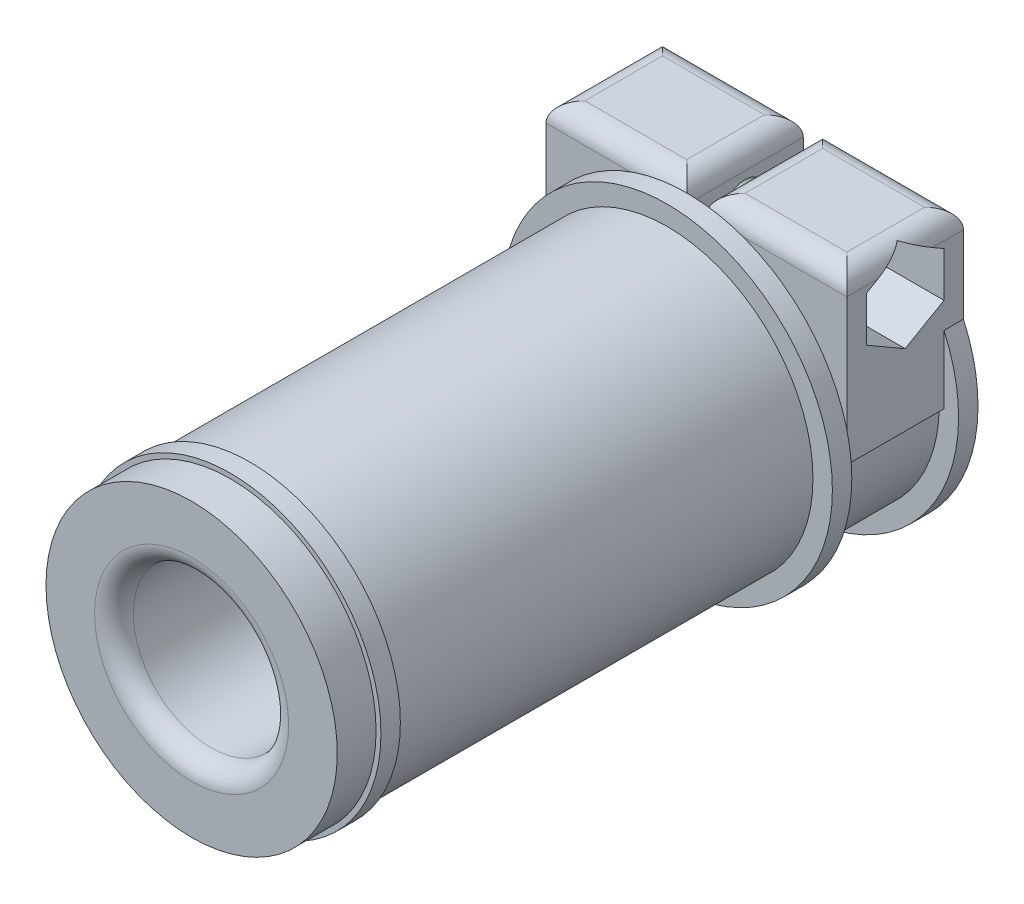
from build123d import *

# Parameters (mm, degrees)
SKETCH1_R                      = 7.5
SKETCH1_R_2                    = 4
BOSS_EXTRUDE1_DEPTH            = 32
SKETCH6_W                      = 1
SKETCH6_H                      = 1
SKETCH7_W                      = 1
SKETCH7_H                      = 1
CUT_EXTRUDE1_DEPTH             = 35.18332927
BOSS_EXTRUDE3_DEPTH            = 6.5
SKETCH15_W                     = 15.5
SKETCH15_H                     = 12.485281374
CUT_EXTRUDE2_DEPTH             = 0.5
CBORE_FOR_M2_SHCS1_D           = 2.2
CBORE_FOR_M2_SHCS1_CBORE_D     = 4.4
CBORE_FOR_M2_SHCS1_CBORE_DEPTH = 4
FILLET4_R                      = 0.5
SKETCH4_R                      = 7.75
SKETCH4_R_2                    = 4
BOSS_EXTRUDE4_DEPTH            = 1
CUT_EXTRUDE3_DEPTH             = 4
FILLET5_R                      = 1


with BuildPart() as part:
    # Sketch1 → Boss-Extrude1 (new body)
    with BuildSketch(Plane.XY):
        Circle(SKETCH1_R)
        Circle(SKETCH1_R_2, mode=Mode.SUBTRACT)
    extrude(amount=BOSS_EXTRUDE1_DEPTH)

    # Sketch6 → Revolve1 (revolve)
    with BuildSketch(Plane(origin=(0, 0, 0), x_dir=(-1, 0, 0), z_dir=(0, 1, 0))):
        with Locations((8, 0.5)):
            Rectangle(SKETCH6_W, SKETCH6_H)
    revolve(axis=Axis((0, 0, 32), (0, 0, -1)))

    # Sketch7 → Revolve2 (revolve)
    with BuildSketch(Plane(origin=(0, 0, 0), x_dir=(0, 0, -1), z_dir=(1, 0, 0)), mode=Mode.PRIVATE) as revolve2_sk:
        with Locations((-7, 8)):
            Rectangle(SKETCH7_W, SKETCH7_H)
    revolve(revolve2_sk.sketch.rotate(Axis((0, 0, 32), (0, 0, -1)), 270), axis=Axis((0, 0, 32), (0, 0, -1)))

    # Sketch9 → Cut-Extrude1 (cut, through all)
    with BuildSketch(Plane(origin=(0, 0, 0), x_dir=(-1, 0, 0), z_dir=(0, 1, 0))):
        Polygon((0, 0), (-0.5, 0), (-0.5, 6.5), (0.5, 6.5), (0.5, 0), align=None)
    extrude(amount=CUT_EXTRUDE1_DEPTH, mode=Mode.SUBTRACT)

    # Sketch12 → Boss-Extrude3 (add)
    with BuildSketch(Plane(origin=(0, 0, 6.5), x_dir=(-1, 0, 0), z_dir=(0, 0, -1))):
        with BuildLine():
            Line((4, 0), (7.75, 0))
            Line((7.75, 0), (7.75, 8.485281374))
            Line((7.75, 8.485281374), (0.5, 8.485281374))
            Line((0.5, 8.485281374), (0.5, 3.968626967))
            ThreePointArc((0.5, 3.968626967), (3, 2.645751311), (4, 0))
        make_face()
        with BuildLine():
            Line((-7.75, 0), (-7.75, 8.485281374))
            Line((-7.75, 8.485281374), (-0.5, 8.485281374))
            Line((-0.5, 8.485281374), (-0.5, 3.968626967))
            ThreePointArc((-0.5, 3.968626967), (-3, 2.645751311), (-4, 0))
            Line((-4, 0), (-7.75, 0))
        make_face()
    extrude(amount=BOSS_EXTRUDE3_DEPTH)

    # Sketch15 → Cut-Extrude2 (cut)
    with BuildSketch(Plane(origin=(0, 0, 6.5), x_dir=(-1, 0, 0), z_dir=(0, 0, -1))):
        with Locations((0, 2.242640687)):
            Rectangle(SKETCH15_W, SKETCH15_H)
    extrude(amount=CUT_EXTRUDE2_DEPTH, mode=Mode.SUBTRACT)

    # CBORE for M2 SHCS1 (through all)
    with Locations(Plane(origin=(-7.75, 5.988170693, 3), x_dir=(0, 0, -1), z_dir=(-1, 0, 0))):
        with Locations((0, 0)):
            CounterBoreHole(CBORE_FOR_M2_SHCS1_D / 2, CBORE_FOR_M2_SHCS1_CBORE_D / 2, CBORE_FOR_M2_SHCS1_CBORE_DEPTH)

    # Fillet4
    fillet4_edges = [part.edges().sort_by_distance(p)[0] for p in [
        (-6.34428877, -4, 6.25),
        (6.34428877, -4, 6.25),
    ]]
    fillet(fillet4_edges, radius=FILLET4_R)

    # Sketch4 → Boss-Extrude4 (add)
    with BuildSketch(Plane.XY.offset(29)):
        Circle(SKETCH4_R)
        with Locations(Location((0, 0, 0), (0, 0, 270))):
            Circle(SKETCH4_R_2, mode=Mode.SUBTRACT)
    extrude(amount=BOSS_EXTRUDE4_DEPTH)

    # Sketch16 → Cut-Extrude3 (cut)
    with BuildSketch(Plane(origin=(7.75, 0, 0), x_dir=(0, 0, -1), z_dir=(1, 0, 0))):
        Polygon((-3, 8.297571769), (-5, 7.142871231), (-5, 4.833470154), (-3, 3.678769616), (-1, 4.833470154), (-1, 7.142871231), align=None)
    extrude(amount=-CUT_EXTRUDE3_DEPTH, mode=Mode.SUBTRACT)

    # Fillet5
    # the kernel refuses this fillet: 1 mm, written as the material it takes off along each edge
    with BuildSketch(Plane(origin=(0.5, 8.485281374, 6), x_dir=(0, -1, 0), z_dir=(0, 0, -1))) as fillet5_piece_1:
        with BuildLine():
            CenterArc((FILLET5_R, -FILLET5_R), FILLET5_R, 90, 90)
            Line((0, -FILLET5_R), (0, 0))
            Line((0, 0), (FILLET5_R, 0))
        make_face()
    extrude(amount=8.5, mode=Mode.SUBTRACT)
    with BuildSketch(Plane(origin=(-2, 8.485281374, 6), x_dir=(0, -1, 0), z_dir=(1, 0, 0)), Plane(origin=(-10.25, 8.485281374, 6), x_dir=(0, -1, 0), z_dir=(1, 0, 0)), Plane(origin=(-10.25, 8.485281374, 0), x_dir=(0, 0, 1), z_dir=(1, 0, 0))) as fillet5_piece_2:
        with BuildLine():
            CenterArc((FILLET5_R, FILLET5_R), FILLET5_R, 180, 90)
            Line((0, FILLET5_R), (0, 0))
            Line((0, 0), (FILLET5_R, 0))
        make_face()
    extrude(amount=12.25, mode=Mode.SUBTRACT)
    with BuildSketch(Plane(origin=(0, 0, 0), x_dir=(0.0031415874858760906, 0.9999950652018582, 0), z_dir=(-0.9999950652018582, 0.0031415874858760906, 0))) as fillet5_piece_3:
        with BuildLine():
            CenterArc((4 + FILLET5_R, -FILLET5_R), FILLET5_R, 90, 90)
            Line((4 + FILLET5_R, 0), (4, 0))
            Line((4, 0), (4, -FILLET5_R))
        make_face()
    revolve(axis=Axis((0, 0, 0), (0, 0, -1)), revolution_arc=359.64, mode=Mode.SUBTRACT)
    with BuildSketch(Plane(origin=(-0.5, 8.485281374, -2.5), x_dir=(-1, 0, 0), z_dir=(0, 0, 1))) as fillet5_piece_4:
        with BuildLine():
            CenterArc((FILLET5_R, FILLET5_R), FILLET5_R, 180, 90)
            Line((0, FILLET5_R), (0, 0))
            Line((0, 0), (FILLET5_R, 0))
        make_face()
    extrude(amount=8.5, mode=Mode.SUBTRACT)
    with BuildSketch(Plane(origin=(0, 0, 32), x_dir=(1, 0, 0), z_dir=(0, -1, 0))) as fillet5_piece_5:
        with BuildLine():
            CenterArc((4 + FILLET5_R, -FILLET5_R), FILLET5_R, 90, 90)
            Line((4 + FILLET5_R, 0), (4, 0))
            Line((4, 0), (4, -FILLET5_R))
        make_face()
    revolve(axis=Axis((0, 0, 32), (0, 0, 1)), mode=Mode.SUBTRACT)
    with BuildSketch(Plane(origin=(-7.75, 8.485281374, 8.5), x_dir=(0, -1, 0), z_dir=(0, 0, -1)), Plane(origin=(7.75, 8.485281374, 8.5), x_dir=(-1, 0, 0), z_dir=(0, 0, -1))) as fillet5_piece_6:
        with BuildLine():
            CenterArc((FILLET5_R, -FILLET5_R), FILLET5_R, 90, 90)
            Line((0, -FILLET5_R), (0, 0))
            Line((0, 0), (FILLET5_R, 0))
        make_face()
    extrude(amount=11, mode=Mode.SUBTRACT)
    with BuildSketch(Plane(origin=(10.25, 8.485281374, 0), x_dir=(0, 0, 1), z_dir=(-1, 0, 0))) as fillet5_piece_7:
        with BuildLine():
            CenterArc((FILLET5_R, -FILLET5_R), FILLET5_R, 90, 90)
            Line((0, -FILLET5_R), (0, 0))
            Line((0, 0), (FILLET5_R, 0))
        make_face()
    extrude(amount=12.25, mode=Mode.SUBTRACT)


solid = part.part
